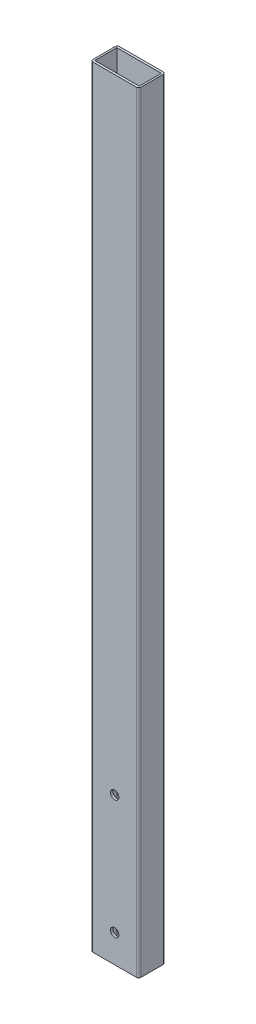
from build123d import *

# Parameters (mm, degrees)
SKETCH1_W               = 34.29
SKETCH1_H               = 19.05
SKETCH1_W_2             = 31.75
SKETCH1_H_2             = 15.748
BOSS_EXTRUDE1_DEPTH     = 550
FILLET1_R               = 1.5
CUT_EXTRUDE1_DEPTH      = 551.59681576
CUT_EXTRUDE1_DEPTH_BACK = 551.59681576
SKETCH2_R               = 3


with BuildPart() as part:
    # Sketch1 → Boss-Extrude1 (new body)
    with BuildSketch(Plane(origin=(0, 0, 0), x_dir=(1, 0, 0), z_dir=(0, 1, 0))):
        Rectangle(SKETCH1_W, SKETCH1_H)
        Rectangle(SKETCH1_W_2, SKETCH1_H_2, mode=Mode.SUBTRACT)
    extrude(amount=BOSS_EXTRUDE1_DEPTH)

    # Fillet1
    fillet1_edges = [part.edges().sort_by_distance(p)[0] for p in [
        (-17.145, 275, -9.525),
        (17.145, 275, -9.525),
        (-17.145, 275, 9.525),
        (17.145, 275, 9.525),
    ]]
    fillet(fillet1_edges, radius=FILLET1_R)

    # Sketch2 → Cut-Extrude1 (cut, two sides: drawn at the far end of the back side and taken through both)
    with BuildSketch(Plane.XY.offset(9.525).offset(-CUT_EXTRUDE1_DEPTH_BACK)):
        with Locations((0, 105)):
            Circle(SKETCH2_R)
        with Locations((0, 20)):
            Circle(SKETCH2_R)
    extrude(amount=CUT_EXTRUDE1_DEPTH + CUT_EXTRUDE1_DEPTH_BACK, mode=Mode.SUBTRACT)


solid = part.part
